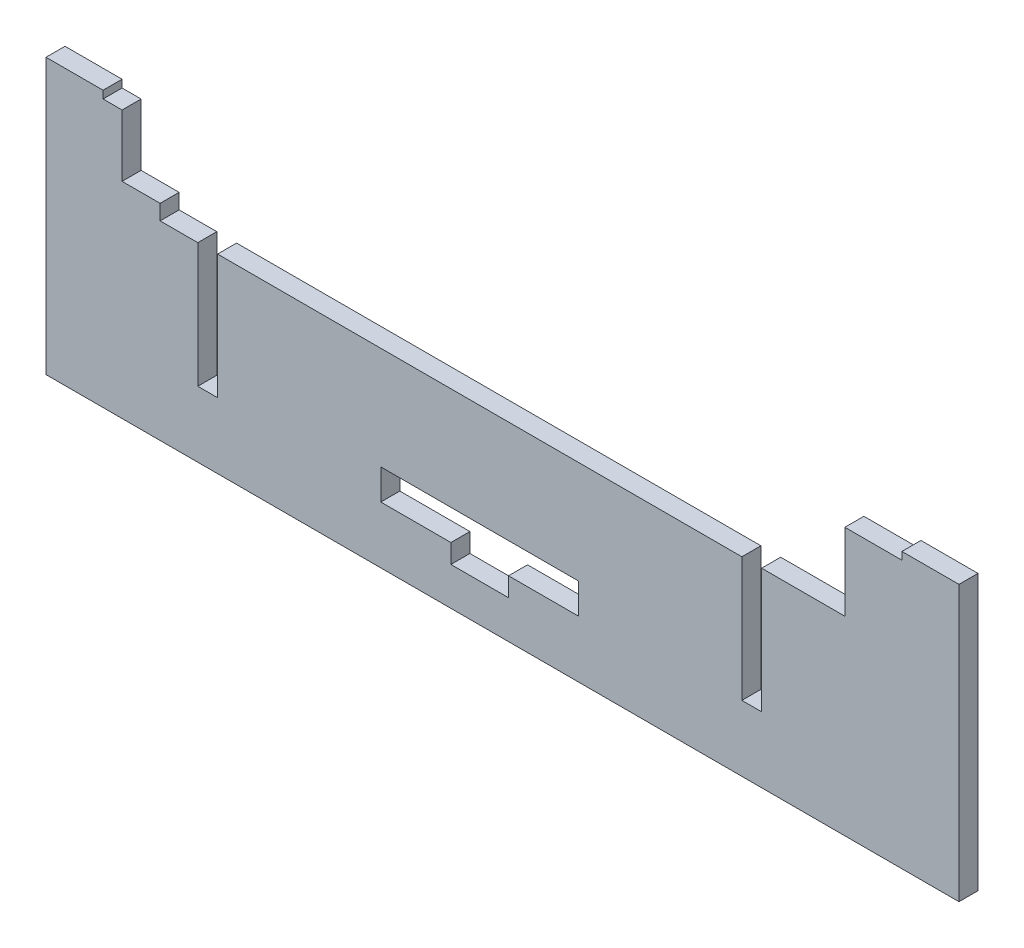
from build123d import *

# Parameters (mm, degrees)
BOSS_EXTRUDE1_DEPTH = 5
CUT_EXTRUDE6_DEPTH  = 32.7
CUT_EXTRUDE7_DEPTH  = 32.7
CUT_EXTRUDE8_DEPTH  = 50


with BuildPart() as part:
    # Sketch1 → Boss-Extrude1 (new body)
    with BuildSketch(Plane.XY):
        Polygon((0, 0), (240, 0), (240, 72.25), (225, 72.25), (225, 70.25), (210, 70.25), (210, 54), (210, 50), (30, 50), (30, 54), (20, 54), (20, 70.25), (15, 70.25), (15, 72.25), (0, 72.25), align=None)
    extrude(amount=BOSS_EXTRUDE1_DEPTH)

    # Sketch7 → Cut-Extrude6 (cut)
    with BuildSketch(Plane(origin=(76.962340789, 50, 79.982193432), x_dir=(0.2993400745373478, 0, -0.9541464875877158), z_dir=(0, -1, 0))):
        Polygon((89.576898842, 88.403721808), (121.027060039, 78.53700457), (119.470491652, 73.575442834), (88.020330455, 83.442160073), align=None)
    extrude(amount=CUT_EXTRUDE6_DEPTH, mode=Mode.SUBTRACT)

    # Sketch8 → Cut-Extrude7 (cut)
    with BuildSketch(Plane(origin=(151.064056229, 50, -36.816333928), x_dir=(-0.29934007453734496, 0, 0.9541464875877167), z_dir=(0, -1, 0))):
        Polygon((48.281104311, 101.35926519), (121.027060039, 78.53700457), (119.470491652, 73.575442834), (46.724535923, 96.397703455), align=None)
    extrude(amount=CUT_EXTRUDE7_DEPTH, mode=Mode.SUBTRACT)

    # Sketch9 → Cut-Extrude8 (cut)
    with BuildSketch(Plane(origin=(179.822929518, 98.166866164, 0), x_dir=(-1, 0, 0), z_dir=(0, 0, -1))):
        Polygon((91.809731009, -83.166866164), (73.384731009, -83.166866164), (73.384731009, -88.166866164), (58.234731009, -88.166866164), (58.234731009, -83.166866164), (39.809731009, -83.166866164), (39.809731009, -75.166866164), (91.809731009, -75.166866164), align=None)
    extrude(amount=-CUT_EXTRUDE8_DEPTH, mode=Mode.SUBTRACT)


solid = part.part
